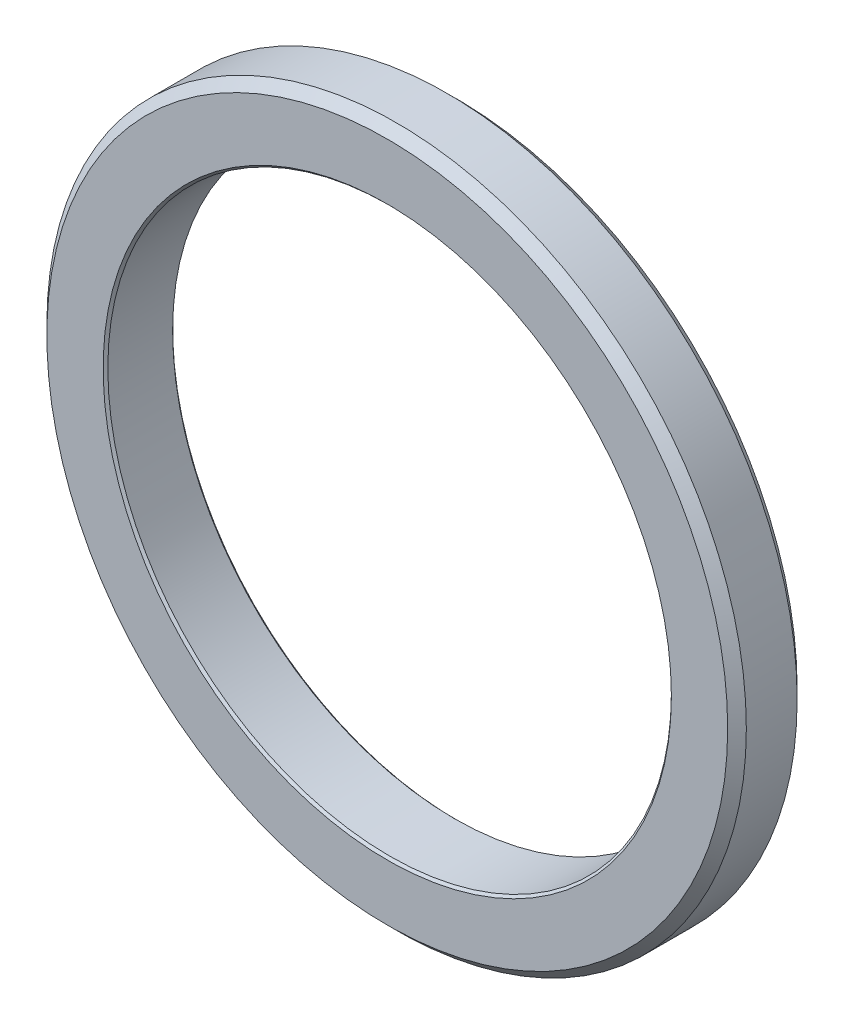
from build123d import *


with BuildPart() as part:
    # Sketch1 → Revolve1 (revolve)
    with BuildSketch(Plane(origin=(0, 0, 0), x_dir=(0, 0, -1), z_dir=(1, 0, 0))):
        Polygon((0, 30.475), (0.25, 30.225), (7.2, 30.225), (7.45, 30.475), (7.45, 36.515), (6.45, 37.515), (1, 37.515), (0, 36.515), align=None)
    revolve(axis=Axis((0, 0, 0), (0, 0, -1)))


solid = part.part
